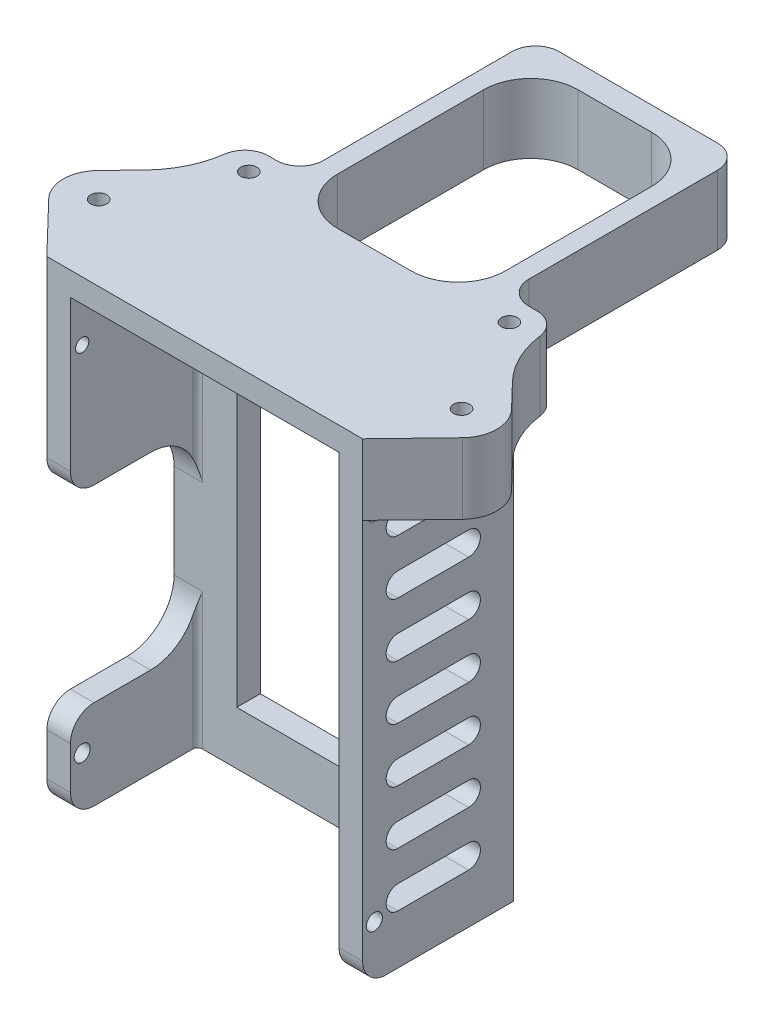
from build123d import *

# Parameters (mm, degrees)
SKETCH_1_W           = 67
SKETCH_1_H           = 118
EXTRUDE_1_DEPTH      = 32
SHELL_2_T            = -5
SKETCH_2_W           = 42
SKETCH_2_H           = 75
CUT_EXTRUDE_1_DEPTH  = 5
SKETCH_4_W           = 31
SKETCH_4_H           = 40
CUT_EXTRUDE_2_DEPTH  = 5
SKETCH_7_R           = 1.4
SKETCH_7_R_2         = 1.7
CUT_EXTRUDE_4_DEPTH  = 95.836701756
SKETCH_9_W           = 32
SKETCH_9_H           = 17
CUT_EXTRUDE_6_DEPTH  = 95.836701756
SKETCH_10_W          = 90
SKETCH_10_H          = 101
SKETCH_10_R          = 1.7
SKETCH_10_W_2        = 42
SKETCH_10_H_2        = 75
EXTRUDE_4_DEPTH      = 5
FILLET_5_R           = 10
FILLET_6_R           = 5
FILLET_10_R          = 1
CUT_EXTRUDE_7_DEPTH  = 10
SKETCH_14_W          = 10.7
SKETCH_14_H          = 101
SKETCH_14_W_2        = 12.3
CUT_EXTRUDE_8_DEPTH  = 80.420652226
FILLET_11_R          = 5
SKETCH_17_R          = 1.7
EXTRUDE_8_DEPTH      = 15
EXTRUDE_8_2_DEPTH    = 15
SKETCH_18_R          = 3
CUT_EXTRUDE_9_DEPTH  = 5
SKETCH_19_W          = 67
SKETCH_19_H          = 14.7
EXTRUDE_9_DEPTH      = 60
SKETCH_21_W          = 11.7
SKETCH_21_H          = 50
CUT_EXTRUDE_10_DEPTH = 60
SKETCH_22_R          = 1.7
CUT_EXTRUDE_11_DEPTH = 60
SKETCH_23_R          = 3
CUT_EXTRUDE_12_DEPTH = 4
SKETCH_24_W          = 35.6
SKETCH_24_H          = 51
CUT_EXTRUDE_13_DEPTH = 115.733125196
FILLET_14_R          = 5
FILLET_15_R          = 10
FILLET_16_R          = 20


with BuildPart() as part:
    # 草图1 → 凸台-拉伸1 (new body)
    with BuildSketch(Plane.XY):
        Rectangle(SKETCH_1_W, SKETCH_1_H)
    extrude(amount=EXTRUDE_1_DEPTH)

    # 抽壳2
    shell_2_openings = [part.faces().sort_by_distance(p)[0] for p in [
        (0, 0, 32),
    ]]
    offset(amount=SHELL_2_T, openings=shell_2_openings, kind=Kind.INTERSECTION)

    # 草图2 → 切除-拉伸1 (cut)
    with BuildSketch(Plane(origin=(0, 0, 0), x_dir=(-1, 0, 0), z_dir=(0, 0, -1))):
        with Locations((-0.8, 6.8)):
            Rectangle(SKETCH_2_W, SKETCH_2_H)
    extrude(amount=-CUT_EXTRUDE_1_DEPTH, mode=Mode.SUBTRACT)

    # 草图4 → 切除-拉伸2 (cut)
    with BuildSketch(Plane.ZY.offset(33.5)):
        with Locations((16.5, -3)):
            Rectangle(SKETCH_4_W, SKETCH_4_H)
    extrude(amount=-CUT_EXTRUDE_2_DEPTH, mode=Mode.SUBTRACT)

    # 草图7 → 切除-拉伸4 (cut, through all)
    with BuildSketch(Plane.ZY.offset(33.5)):
        with Locations((29.5, 44)):
            Circle(SKETCH_7_R)
        with Locations((29.5, -31)):
            Circle(SKETCH_7_R_2)
    extrude(amount=-CUT_EXTRUDE_4_DEPTH, mode=Mode.SUBTRACT)

    # 草图9 → 切除-拉伸6 (cut, through all)
    with BuildSketch(Plane.ZY.offset(33.5)):
        with Locations((16, -50.5)):
            Rectangle(SKETCH_9_W, SKETCH_9_H)
    extrude(amount=-CUT_EXTRUDE_6_DEPTH, mode=Mode.SUBTRACT)

    # 草图10 → 凸台-拉伸4 (add)
    with BuildSketch(Plane.XY.offset(5)):
        with Locations((0.8, 8.5)):
            Rectangle(SKETCH_10_W, SKETCH_10_H)
        with Locations((39.8, 39.3)):
            Circle(SKETCH_10_R, mode=Mode.SUBTRACT)
        with Locations(Location((39.8, -25.7, 0), (0, 0, 180))):
            Circle(SKETCH_10_R, mode=Mode.SUBTRACT)
        with Locations((-38.2, -25.7)):
            Circle(SKETCH_10_R, mode=Mode.SUBTRACT)
        with Locations(Location((-38.2, 39.3, 0), (0, 0, 180))):
            Circle(SKETCH_10_R, mode=Mode.SUBTRACT)
        with Locations((0.8, 6.8)):
            Rectangle(SKETCH_10_W_2, SKETCH_10_H_2, mode=Mode.SUBTRACT)
    extrude(amount=-EXTRUDE_4_DEPTH)

    # 圆角5
    fillet_5_edges = [part.edges().sort_by_distance(p)[0] for p in [
        (-31, -23, 5),
        (-31, 17, 5),
    ]]
    fillet(fillet_5_edges, radius=FILLET_5_R)

    # 圆角6
    fillet_6_edges = [part.edges().sort_by_distance(p)[0] for p in [
        (-31, 17, 32),
        (-31, -23, 32),
    ]]
    fillet(fillet_6_edges, radius=FILLET_6_R)

    # 圆角10
    fillet_10_edges = [part.edges().sort_by_distance(p)[0] for p in [
        (-28.5, 30.5, 5),
        (-28.5, -27.5, 5),
        (28.5, 6, 5),
    ]]
    fillet(fillet_10_edges, radius=FILLET_10_R)

    # 草图13 → 切除-拉伸7 (cut)
    with BuildSketch(Plane(origin=(33.5, 0, 0), x_dir=(0, 0, -1), z_dir=(1, 0, 0))):
        with BuildLine():
            Line((-24.5, 37.5), (-9.5, 37.5))
            ThreePointArc((-9.5, 37.5), (-7, 40), (-9.5, 42.5))
            Line((-9.5, 42.5), (-24.5, 42.5))
            ThreePointArc((-24.5, 42.5), (-27, 40), (-24.5, 37.5))
        make_face()
        with BuildLine():
            Line((-24.5, 26), (-9.5, 26))
            ThreePointArc((-9.5, 26), (-7, 28.5), (-9.5, 31))
            Line((-9.5, 31), (-24.5, 31))
            ThreePointArc((-24.5, 31), (-27, 28.5), (-24.5, 26))
        make_face()
        with BuildLine():
            Line((-24.5, -8.5), (-9.5, -8.5))
            ThreePointArc((-9.5, -8.5), (-7, -6), (-9.5, -3.5))
            Line((-9.5, -3.5), (-24.5, -3.5))
            ThreePointArc((-24.5, -3.5), (-27, -6), (-24.5, -8.5))
        make_face()
        with BuildLine():
            Line((-24.5, -20), (-9.5, -20))
            ThreePointArc((-9.5, -20), (-7, -17.5), (-9.5, -15))
            Line((-9.5, -15), (-24.5, -15))
            ThreePointArc((-24.5, -15), (-27, -17.5), (-24.5, -20))
        make_face()
        with BuildLine():
            Line((-24.5, 19.5), (-9.5, 19.5))
            ThreePointArc((-9.5, 19.5), (-7, 17), (-9.5, 14.5))
            Line((-9.5, 14.5), (-24.5, 14.5))
            ThreePointArc((-24.5, 14.5), (-27, 17), (-24.5, 19.5))
        make_face()
        with BuildLine():
            Line((-24.5, 8), (-9.5, 8))
            ThreePointArc((-9.5, 8), (-7, 5.5), (-9.5, 3))
            Line((-9.5, 3), (-24.5, 3))
            ThreePointArc((-24.5, 3), (-27, 5.5), (-24.5, 8))
        make_face()
        with BuildLine():
            Line((-24.5, -26.5), (-9.5, -26.5))
            ThreePointArc((-9.5, -26.5), (-7, -29), (-9.5, -31.5))
            Line((-9.5, -31.5), (-24.5, -31.5))
            ThreePointArc((-24.5, -31.5), (-27, -29), (-24.5, -26.5))
        make_face()
    extrude(amount=-CUT_EXTRUDE_7_DEPTH, mode=Mode.SUBTRACT)

    # 草图14 → 切除-拉伸8 (cut, through all)
    with BuildSketch(Plane.XY.offset(5)):
        with Locations((-38.85, 8.5)):
            Rectangle(SKETCH_14_W, SKETCH_14_H)
        with Locations((39.65, 8.5)):
            Rectangle(SKETCH_14_W_2, SKETCH_14_H)
    extrude(amount=-CUT_EXTRUDE_8_DEPTH, mode=Mode.SUBTRACT)

    # 圆角11
    fillet_11_edges = [part.edges().sort_by_distance(p)[0] for p in [
        (-31, -42, 32),
        (31, -42, 32),
    ]]
    fillet(fillet_11_edges, radius=FILLET_11_R)



with BuildPart() as body_2:
    # 草图17 → 凸台-拉伸8 (new body)
    with BuildSketch(Plane(origin=(0, 59, 0), x_dir=(1, 0, 0), z_dir=(0, 1, 0))):
        with BuildLine():
            Line((33.5, -32), (43.901244563, -21.203513926))
            ThreePointArc((43.901244563, -21.203513926), (46, -16), (43.901244563, -10.796486074))
            Line((43.901244563, -10.796486074), (33.5, 0))
            Line((33.5, 0), (33.5, -32))
        make_face()
        with Locations(Location((38.5, -16, 0), (0, 0, 180))):
            Circle(SKETCH_17_R, mode=Mode.SUBTRACT)
    extrude(amount=-EXTRUDE_8_DEPTH)


with BuildPart() as body_3:
    # 草图17 → Extrude 8 2 (new body)
    with BuildSketch(Plane(origin=(0, 59, 0), x_dir=(1, 0, 0), z_dir=(0, 1, 0))):
        with BuildLine():
            Line((-33.5, -32), (-33.5, 0))
            Line((-33.5, 0), (-43.901244563, -10.796486074))
            ThreePointArc((-43.901244563, -10.796486074), (-46, -16), (-43.901244563, -21.203513926))
            Line((-43.901244563, -21.203513926), (-33.5, -32))
        make_face()
        with Locations((-38.5, -16)):
            Circle(SKETCH_17_R, mode=Mode.SUBTRACT)
    extrude(amount=-EXTRUDE_8_2_DEPTH)


with BuildPart() as cut_extrude_9_tool:
    # 草图18 → 切除-拉伸9 (new body)
    with BuildSketch(Plane.XZ.offset(-44)):
        with Locations((-38.5, 16)):
            Circle(SKETCH_18_R)
        with Locations((38.5, 16)):
            Circle(SKETCH_18_R)
    extrude(amount=-CUT_EXTRUDE_9_DEPTH)


with BuildPart() as body_2_1:
    add(body_2.part)

    # 切除-拉伸9: cut by cut_extrude_9_tool
    add(cut_extrude_9_tool.part, mode=Mode.SUBTRACT)


with BuildPart() as body_3_1:
    add(body_3.part)

    # 切除-拉伸9: cut by cut_extrude_9_tool
    add(cut_extrude_9_tool.part, mode=Mode.SUBTRACT)


with BuildPart() as part_1:
    add(part.part)

    add(body_2_1.part)  # 凸台-拉伸9 merges body 2

    add(body_3_1.part)  # 凸台-拉伸9 merges body 3
    # 草图19 → 凸台-拉伸9 (add)
    with BuildSketch(Plane(origin=(0, 0, 0), x_dir=(-1, 0, 0), z_dir=(0, 0, -1))):
        with Locations((0, 51.65)):
            Rectangle(SKETCH_19_W, SKETCH_19_H)
    extrude(amount=EXTRUDE_9_DEPTH)

    # 草图21 → 切除-拉伸10 (cut)
    with BuildSketch(Plane.XZ.offset(-44.3)):
        with Locations((27.65, -35)):
            Rectangle(SKETCH_21_W, SKETCH_21_H)
        with Locations((-27.65, -35)):
            Rectangle(SKETCH_21_W, SKETCH_21_H)
    extrude(amount=-CUT_EXTRUDE_10_DEPTH, mode=Mode.SUBTRACT)

    # 草图22 → 切除-拉伸11 (cut)
    with BuildSketch(Plane.XZ.offset(-44.3)):
        with Locations((27.65, -5)):
            Circle(SKETCH_22_R)
        with Locations((-27.65, -5)):
            Circle(SKETCH_22_R)
    extrude(amount=-CUT_EXTRUDE_11_DEPTH, mode=Mode.SUBTRACT)

    # 草图23 → 切除-拉伸12 (cut)
    with BuildSketch(Plane.XZ.offset(-44.3)):
        with Locations((27.65, -5)):
            Circle(SKETCH_23_R)
        with Locations((-27.65, -5)):
            Circle(SKETCH_23_R)
    extrude(amount=-CUT_EXTRUDE_12_DEPTH, mode=Mode.SUBTRACT)

    # 草图24 → 切除-拉伸13 (cut, through all)
    with BuildSketch(Plane.XZ.offset(-44.3)):
        with Locations((0, -29.5)):
            Rectangle(SKETCH_24_W, SKETCH_24_H)
    extrude(amount=-CUT_EXTRUDE_13_DEPTH, mode=Mode.SUBTRACT)

    # 圆角14
    fillet_14_edges = [part_1.edges().sort_by_distance(p)[0] for p in [
        (-21.8, 51.65, -60),
        (21.8, 51.65, -60),
        (21.8, 51.65, -10),
        (33.5, 51.65, -10),
        (-33.5, 51.65, -10),
        (-21.8, 51.65, -10),
    ]]
    fillet(fillet_14_edges, radius=FILLET_14_R)

    # 圆角15
    fillet_15_edges = [part_1.edges().sort_by_distance(p)[0] for p in [
        (17.8, 51.65, -4),
        (17.8, 51.65, -55),
        (-17.8, 51.65, -55),
        (-17.8, 51.65, -4),
    ]]
    fillet(fillet_15_edges, radius=FILLET_15_R)

    # 圆角16
    # the kernel refuses this fillet: 20 mm, written as the material it adds along each edge
    with BuildSketch(Plane(origin=(-33.5, 59, 0), x_dir=(0.007697620119081404, 0, -0.9999703728833682), z_dir=(0, -1, 0))) as fillet_16_piece_1:
        with BuildLine():
            CenterArc((8.140232948, -19.845455055), FILLET_16_R, 97.127382881, 36.36338903)
            Line((-5.624521804, -5.335750488), (-7.000997279, -3.884780031))
            Line((-7.000997279, -3.884780031), (-1.376475475, 1.450970457))
            Line((-1.376475475, 1.450970457), (0.01539524, 1.999940746))
            ThreePointArc((0.01539524, 1.999940746), (5.015247105, 1.961452645), (5.410567123, 1.984545506))
            Line((5.410567123, 1.984545506), (5.658718562, 0))
        make_face()
    extrude(amount=14.7)
    with BuildSketch(Plane(origin=(33.5, 59, 0), x_dir=(-0.00769762011907516, 0, -0.9999703728833682), z_dir=(0, -1, 0))) as fillet_16_piece_2:
        with BuildLine():
            CenterArc((8.140232948, 19.845455055), FILLET_16_R, 226.509228089, 36.36338903)
            Line((-5.624521804, 5.335750488), (-7.000997279, 3.884780031))
            Line((-7.000997279, 3.884780031), (-1.376475475, -1.450970457))
            Line((-1.376475475, -1.450970457), (0.01539524, -1.999940746))
            ThreePointArc((0.01539524, -1.999940746), (5.015247105, -1.961452645), (5.410567123, -1.984545506))
            Line((5.410567123, -1.984545506), (5.658718562, 0))
        make_face()
    extrude(amount=14.7)


solid = part_1.part
